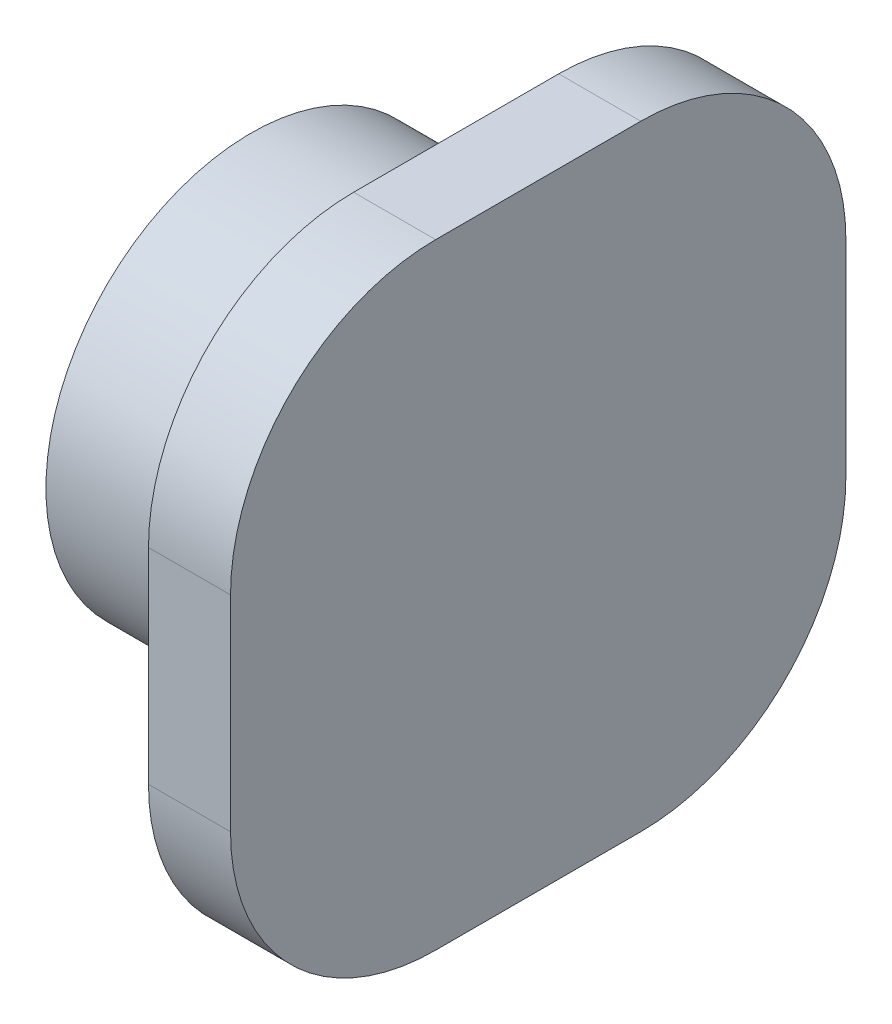
from build123d import *

# Parameters (mm, degrees)
SKETCH1_R           = 12.7
SKETCH1_R_2         = 9.525
BOSS_EXTRUDE1_DEPTH = 12.7
THREAD1_PITCH       = 2.54
BOSS_EXTRUDE2_DEPTH = 5.08


with BuildPart() as part:
    # Sketch1 → Boss-Extrude1 (new body)
    with BuildSketch(Plane(origin=(0, 0, 0), x_dir=(0, 0, -1), z_dir=(1, 0, 0))):
        Circle(SKETCH1_R)
        Circle(SKETCH1_R_2, mode=Mode.SUBTRACT)
    extrude(amount=BOSS_EXTRUDE1_DEPTH)

    # Thread1: arcs per turn and ends read off the stored shape
    # Thread1: the profile of Thread Profile1 profile screwed along a left-hand helix through 5 turns, 10 arcs to a turn; built about Z, then put on its axis
    thread1_z = Axis((0, 0, 0), (0, 0, 1))
    thread1_corners = [(9.5253, 0, -0.000173205), (9.5253, 0, 2.222673198), (8.150184678, 0, 1.428749997), (8.150184678, 0, 0.793749997)]
    with BuildLine(mode=Mode.PRIVATE) as thread1_profile:
        Line(thread1_corners[0], thread1_corners[1])
        Line(thread1_corners[1], thread1_corners[2])
        Line(thread1_corners[2], thread1_corners[3])
        Line(thread1_corners[3], thread1_corners[0])
    thread1_cap = Face(thread1_profile.wire())
    thread1_turn_angles = [0, -18, -36, -54, -72, -90, -108, -126, -144, -162, -180, -198, -216, -234, -252, -270, -288, -306, -324, -342, -360]
    thread1_turn_weights = [1, 0.9510565162951535, 1, 0.9510565162951535, 1, 0.9510565162951535, 1, 0.9510565162951535, 1, 0.9510565162951535, 1, 0.9510565162951535, 1, 0.9510565162951535, 1, 0.9510565162951535, 1, 0.9510565162951535, 1, 0.9510565162951535, 1]
    thread1_turn_rails = [Edge.make_bspline([Vector(p[0], p[1], 0).rotate(thread1_z, thread1_turn_angles[k]) / thread1_turn_weights[k] + Vector(0, 0, p[2] + -THREAD1_PITCH * thread1_turn_angles[k] / 360) for k in range(21)], [0, 0, 0, 1, 1, 2, 2, 3, 3, 4, 4, 5, 5, 6, 6, 7, 7, 8, 8, 9, 9, 10, 10, 10], 2, thread1_turn_weights) for p in thread1_corners]
    thread1_turn_sides = [Face.make_surface_from_curves(thread1_turn_rails[p[0]], thread1_turn_rails[p[1]]) for p in [(0, 1), (1, 2), (2, 3), (3, 0)]]
    thread1 = Plane(origin=(0, 0, 0), x_dir=(0, 0, -1), z_dir=(1, 0, 0)) * Solid(Shell([*[p.moved(Location((0, 0, THREAD1_PITCH * i))) for i in range(5) for p in thread1_turn_sides], thread1_cap, thread1_cap.rotate(thread1_z, -1800).moved(Location((0, 0, -THREAD1_PITCH * -1800 / 360)))]))
    add(thread1)

    # Sketch4 → Boss-Extrude2 (add)
    with BuildSketch(Plane(origin=(12.7, 0, 0), x_dir=(0, 0, -1), z_dir=(1, 0, 0))):
        with BuildLine():
            Line((-6.35, 19.05), (6.35, 19.05))
            ThreePointArc((6.35, 19.05), (15.330256121, 15.330256121), (19.05, 6.35))
            Line((19.05, 6.35), (19.05, -6.35))
            ThreePointArc((19.05, -6.35), (15.330256121, -15.330256121), (6.35, -19.05))
            Line((6.35, -19.05), (-6.35, -19.05))
            ThreePointArc((-6.35, -19.05), (-15.330256121, -15.330256121), (-19.05, -6.35))
            Line((-19.05, -6.35), (-19.05, 6.35))
            ThreePointArc((-19.05, 6.35), (-15.330256121, 15.330256121), (-6.35, 19.05))
        make_face()
    extrude(amount=BOSS_EXTRUDE2_DEPTH)


solid = part.part
